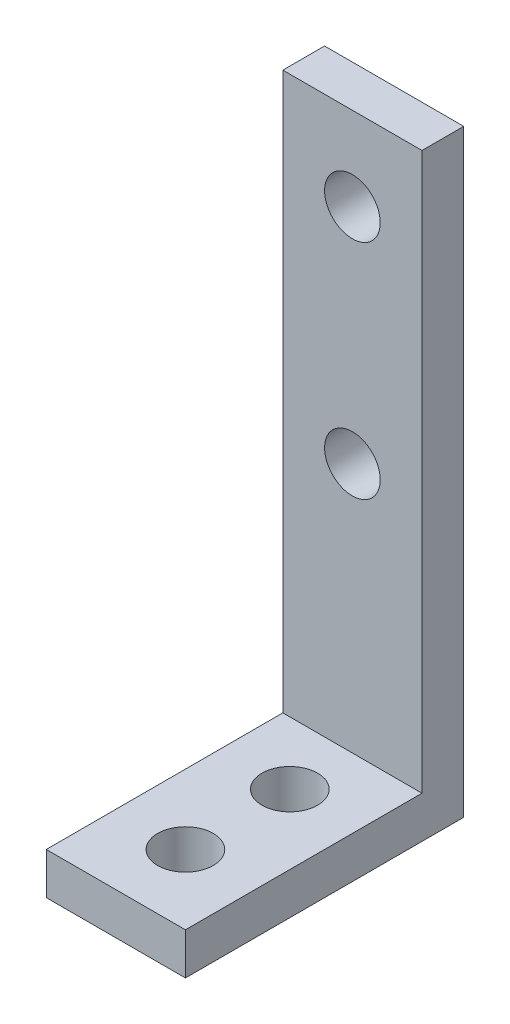
from build123d import *

# Parameters (mm, degrees)
SKETCH2_W           = 10
SKETCH2_H           = 20
BOSS_EXTRUDE1_DEPTH = 3
SKETCH4_W           = 10
SKETCH4_H           = 3
BOSS_EXTRUDE2_DEPTH = 40
SKETCH6_R           = 2
CUT_EXTRUDE1_DEPTH  = 42.533119315
SKETCH7_R           = 2
CUT_EXTRUDE2_DEPTH  = 47.508063817


with BuildPart() as part:
    # Sketch2 → Boss-Extrude1 (new body)
    with BuildSketch(Plane(origin=(0, 0, 0), x_dir=(1, 0, 0), z_dir=(0, 1, 0))):
        Rectangle(SKETCH2_W, SKETCH2_H)
    extrude(amount=BOSS_EXTRUDE1_DEPTH)

    # Sketch4 → Boss-Extrude2 (add)
    with BuildSketch(Plane(origin=(0, 3, 0), x_dir=(1, 0, 0), z_dir=(0, 1, 0))):
        with Locations((0, 8.5)):
            Rectangle(SKETCH4_W, SKETCH4_H)
    extrude(amount=BOSS_EXTRUDE2_DEPTH)

    # Sketch6 → Cut-Extrude1 (cut, through all)
    with BuildSketch(Plane(origin=(0, 3, 0), x_dir=(1, 0, 0), z_dir=(0, 1, 0))):
        with Locations((0, 2.5)):
            Circle(SKETCH6_R)
        with Locations((0, -5)):
            Circle(SKETCH6_R)
    extrude(amount=-CUT_EXTRUDE1_DEPTH, mode=Mode.SUBTRACT)

    # Sketch7 → Cut-Extrude2 (cut, through all)
    with BuildSketch(Plane.XY.offset(-7)):
        with Locations((0, 37)):
            Circle(SKETCH7_R)
        with Locations((0, 21)):
            Circle(SKETCH7_R)
    extrude(amount=-CUT_EXTRUDE2_DEPTH, mode=Mode.SUBTRACT)


solid = part.part
